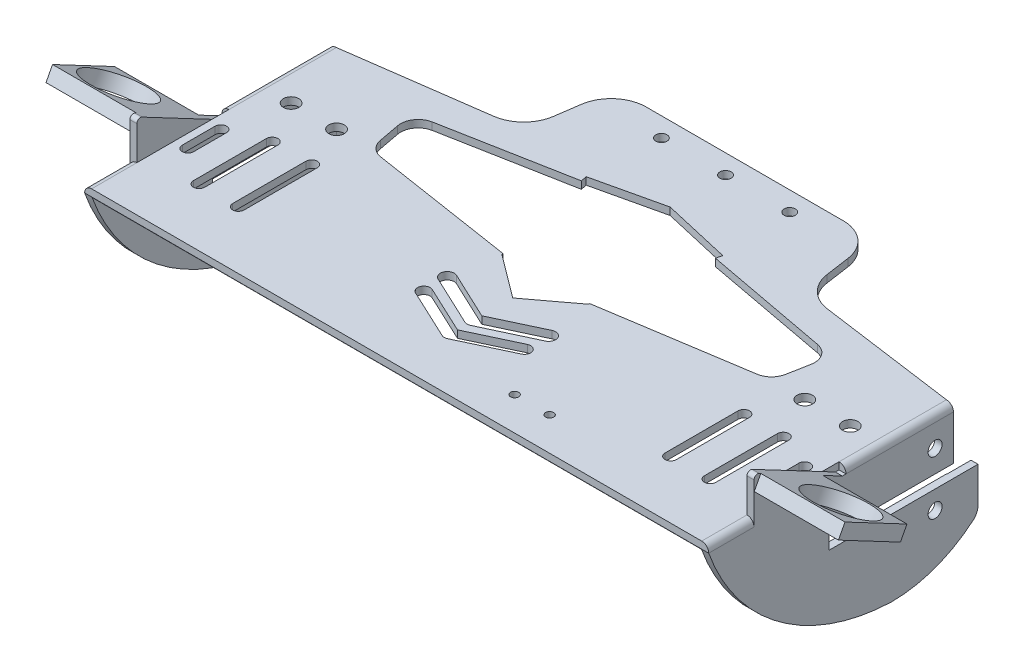
from build123d import *

# Parameters (mm, degrees)
SKETCH_1_W                  = 178
SKETCH_1_H                  = 99.3
EXTRUDE_1_DEPTH             = 40.1
SKETCH_2_W                  = 173.8
SKETCH_2_H                  = 38
CUT_EXTRUDE_1_DEPTH         = 140.246184867
FILLET_2_R                  = 2
CUT_EXTRUDE_2_DEPTH         = 110.517726876
CUT_EXTRUDE_3_DEPTH         = 110.517726876
SKETCH_8_R                  = 2.2
SKETCH_8_R_2                = 1.6
CUT_EXTRUDE_4_DEPTH         = 110.517726876
CUT_EXTRUDE_START           = -178
CUT_EXTRUDE_6_DEPTH         = 178
CUT_EXTRUDE_START_2         = -2
CUT_EXTRUDE_6_2_OUTLINE_W   = 15.371880512
CUT_EXTRUDE_6_2_OUTLINE_H   = 8.546668637
CUT_EXTRUDE_6_2_OUTLINE_W_2 = 50.8
CUT_EXTRUDE_6_2_OUTLINE_H_2 = 3.7
CUT_EXTRUDE_6_2_DEPTH       = 2
CUT_EXTRUDE_START_3         = -2.1
CUT_EXTRUDE_6_3_OUTLINE_W   = 50.8
CUT_EXTRUDE_6_3_OUTLINE_H   = 3.7
CUT_EXTRUDE_6_3_DEPTH       = 0.1
CUT_EXTRUDE_7_REACH         = 191.096
SKETCH_12_W                 = 50.840355568
SKETCH_12_H                 = 3.7
SKETCH_12_W_2               = 15.371880512
SKETCH_12_H_2               = 8.546668637
CUT_EXTRUDE_8_DEPTH         = 190.095564464
CUT_EXTRUDE_9_DEPTH         = 190.095564464
CUT_EXTRUDE_9_DEPTH_BACK    = 190.095564464
SKETCH_14_W                 = 15.371880512
SKETCH_14_H                 = 6.177592496
FILLET_5_R                  = 2
FILLET_6_R                  = 2
SKETCH_15_W                 = 44.8
SKETCH_15_H                 = 10.5
EXTRUDE_2_DEPTH             = 2
EXTRUDE_3_DEPTH             = 20
SKETCH_17_R                 = 9
CUT_EXTRUDE_10_DEPTH        = 5
SKETCH_18_W                 = 12.418304002
SKETCH_18_H                 = 16.745033667
CUT_EXTRUDE_11_DEPTH        = 2
EXTRUDE_4_DEPTH             = 4
EXTRUDE_5_DEPTH             = 1.5
SKETCH_21_W                 = 13.4371469
SKETCH_21_H                 = 20.281056592
CUT_EXTRUDE_12_DEPTH        = 2
CUT_EXTRUDE_13_DEPTH        = 6
SKETCH_23_W                 = 17.8776686
SKETCH_23_H                 = 8.373981463
SKETCH_23_W_2               = 13.636767664
SKETCH_23_H_2               = 13.001155611
CUT_EXTRUDE_14_DEPTH        = 4
FILLET_12_R                 = 0.5
SKETCH_25_R                 = 1.15
CUT_EXTRUDE_15_DEPTH        = 5
CUT_EXTRUDE_17_DEPTH        = 2
CUT_EXTRUDE_18_DEPTH        = 2
SKETCH_33_W                 = 239.619275189
SKETCH_33_H                 = 161.385039832
CUT_EXTRUDE_19_DEPTH        = 35
SKETCH_35_W                 = 479.848395458
SKETCH_35_H                 = 293.507268555
CUT_EXTRUDE_20_DEPTH        = 13
SKETCH_36_W                 = 75.880372154
SKETCH_36_H                 = 5.674586768
CUT_EXTRUDE_21_DEPTH        = 2
SKETCH_39_W                 = 69.8
SKETCH_39_H                 = 2
EXTRUDE_6_DEPTH             = 2
SKETCH_38_R                 = 2
CUT_EXTRUDE_25_DEPTH        = 201
FILLET_13_R                 = 2
CUT_EXTRUDE_22_DEPTH        = 2
EXTRUDE_7_DEPTH             = 2
EXTRUDE_8_DEPTH             = 24
SKETCH_51_R                 = 9
CUT_EXTRUDE_26_DEPTH        = 5
FILLET_14_R                 = 1
SKETCH_52_W                 = 10.388270982
SKETCH_52_H                 = 13.498276643
CUT_EXTRUDE_27_DEPTH        = 178
FILLET_16_R                 = 4


# Read off the part's stored shape, not the designer's step: 切除-拉伸6
with BuildPart() as part:
    # 草图1 → 凸台-拉伸1 (new body)
    with BuildSketch(Plane(origin=(0, 0, 0), x_dir=(1, 0, 0), z_dir=(0, 1, 0))):
        Rectangle(SKETCH_1_W, SKETCH_1_H)
    extrude(amount=EXTRUDE_1_DEPTH)

    # 草图2 → 切除-拉伸1 (cut, through all)
    with BuildSketch(Plane.XY.offset(49.65)):
        with Locations((0, 19)):
            Rectangle(SKETCH_2_W, SKETCH_2_H)
    extrude(amount=-CUT_EXTRUDE_1_DEPTH, mode=Mode.SUBTRACT)

    # 圆角2
    fillet_2_edges = [part.edges().sort_by_distance(p)[0] for p in [
        (-89, 40.1, 0),
        (89, 40.1, 0),
    ]]
    fillet(fillet_2_edges, radius=FILLET_2_R)

    # 草图4 → 切除-拉伸2 (cut, through all)
    with BuildSketch(Plane(origin=(0, 40.1, 0), x_dir=(1, 0, 0), z_dir=(0, 1, 0))):
        with BuildLine():
            Line((-36.8, 49.65), (-39.030851371, 34.101641958))
            ThreePointArc((-39.030851371, 34.101641958), (-41.87537216, 28.433897016), (-47.556677901, 25.6165585))
            Line((-47.556677901, 25.6165585), (-87, 20.15))
            Line((-87, 20.15), (-87, 35.521880512))
            Line((-87, 35.521880512), (-89, 35.521880512))
            Line((-89, 35.521880512), (-89, 49.65))
            Line((-89, 49.65), (-87, 49.65))
            Line((-87, 49.65), (-36.8, 49.65))
        make_face()
        with BuildLine():
            Line((36.8, 49.65), (39.030851371, 34.101641958))
            ThreePointArc((39.030851371, 34.101641958), (41.87537216, 28.433897016), (47.556677901, 25.6165585))
            Line((47.556677901, 25.6165585), (87, 20.15))
            Line((87, 20.15), (87, 35.521880512))
            Line((87, 35.521880512), (89, 35.521880512))
            Line((89, 35.521880512), (89, 49.65))
            Line((89, 49.65), (87, 49.65))
            Line((87, 49.65), (36.8, 49.65))
        make_face()
    extrude(amount=-CUT_EXTRUDE_2_DEPTH, mode=Mode.SUBTRACT)

    # 草图6 → 切除-拉伸3 (cut, through all)
    with BuildSketch(Plane(origin=(0, 40.1, 0), x_dir=(1, 0, 0), z_dir=(0, 1, 0))):
        with BuildLine():
            Line((-36.8, 49.65), (-38.031009251, 41.070238555))
            ThreePointArc((-38.031009251, 41.070238555), (-34.682095001, 47.206533119), (-28.132376898, 49.65))
            Line((-28.132376898, 49.65), (-36.8, 49.65))
        make_face()
        with BuildLine():
            Line((28.132376898, 49.65), (36.8, 49.65))
            Line((36.8, 49.65), (38.031009251, 41.070238555))
            ThreePointArc((38.031009251, 41.070238555), (34.682095001, 47.206533119), (28.132376898, 49.65))
        make_face()
    extrude(amount=-CUT_EXTRUDE_3_DEPTH, mode=Mode.SUBTRACT)

    # 草图8 → 切除-拉伸4 (cut, through all)
    with BuildSketch(Plane(origin=(0, 40.1, 0), x_dir=(1, 0, 0), z_dir=(0, 1, 0))):
        with Locations(Location((-66.772751143, -0.015717315, 0), (0, 0, 270))):
            Circle(SKETCH_8_R)
        with Locations(Location((-79.744808128, -0.015717315, 0), (0, 0, 270))):
            Circle(SKETCH_8_R)
        with Locations(Location((79.744808128, -0.015717315, 0), (0, 0, 270))):
            Circle(SKETCH_8_R)
        with Locations(Location((66.772751143, -0.015717315, 0), (0, 0, 270))):
            Circle(SKETCH_8_R)
        with Locations(Location((-18.3, 44.15, 0), (0, 0, 270))):
            Circle(SKETCH_8_R_2)
        with Locations(Location((0, 44.15, 0), (0, 0, 270))):
            Circle(SKETCH_8_R_2)
        with Locations(Location((18.3, 44.15, 0), (0, 0, 270))):
            Circle(SKETCH_8_R_2)
        Polygon((0, 28.35), (-19.5, 23.865395458), (-12.327874499, -7.320508663), (0, -16.55), (12.327874499, -7.320508663), (19.5, 23.865395458), align=None)
        with BuildLine():
            Line((-0.841570701, -29.340722492), (-15.30536404, -22.541191788))
            ThreePointArc((-15.30536404, -22.541191788), (-16.253961694, -19.909452732), (-13.622222639, -18.960855078))
            Line((-13.622222639, -18.960855078), (0, -25.364757493))
            Line((0, -25.364757493), (13.622222639, -18.960855078))
            ThreePointArc((13.622222639, -18.960855078), (16.253961694, -19.909452732), (15.30536404, -22.541191788))
            Line((15.30536404, -22.541191788), (0.759805991, -29.340722492))
            ThreePointArc((0.759805991, -29.340722492), (-0.040882355, -29.529794577), (-0.841570701, -29.340722492))
        make_face()
        with BuildLine():
            Line((-0.761506944, -35.907039665), (-15.091492685, -29.170412851))
            ThreePointArc((-15.091492685, -29.170412851), (-15.949844455, -26.789047193), (-13.568478797, -25.930695423))
            Line((-13.568478797, -25.930695423), (0, -32.309332481))
            Line((0, -32.309332481), (13.568478797, -25.930695423))
            ThreePointArc((13.568478797, -25.930695423), (15.949844455, -26.789047193), (15.091492685, -29.170412851))
            Line((15.091492685, -29.170412851), (0.761506944, -35.907039665))
            ThreePointArc((0.761506944, -35.907039665), (0, -36.077106949), (-0.761506944, -35.907039665))
        make_face()
        with BuildLine():
            Line((22.519031751, 16.438607072), (19.604247718, 0.906493347))
            ThreePointArc((19.604247718, 0.906493347), (20.928314771, -3.495778271), (25.287228663, -4.956264026))
            Line((25.287228663, -4.956264026), (53.645829787, -0.543579577))
            ThreePointArc((53.645829787, -0.543579577), (56.357126672, 0.806817312), (57.791282591, 3.474756472))
            Line((57.791282591, 3.474756472), (58.941416792, 9.603517642))
            ThreePointArc((58.941416792, 9.603517642), (58.154177406, 13.348502968), (54.949410579, 15.439945179))
            Line((54.949410579, 15.439945179), (28.355459288, 20.430613285))
            ThreePointArc((28.355459288, 20.430613285), (24.610473962, 19.6433739), (22.519031751, 16.438607072))
        make_face()
        with BuildLine():
            Line((-57.791282591, 3.474756472), (-58.941416792, 9.603517642))
            ThreePointArc((-58.941416792, 9.603517642), (-58.154177406, 13.348502968), (-54.949410579, 15.439945179))
            Line((-54.949410579, 15.439945179), (-28.355459288, 20.430613285))
            ThreePointArc((-28.355459288, 20.430613285), (-24.610473962, 19.6433739), (-22.519031751, 16.438607072))
            Line((-22.519031751, 16.438607072), (-19.604247718, 0.906493347))
            ThreePointArc((-19.604247718, 0.906493347), (-20.928314771, -3.495778271), (-25.287228663, -4.956264026))
            Line((-25.287228663, -4.956264026), (-53.645829787, -0.543579577))
            ThreePointArc((-53.645829787, -0.543579577), (-56.357126672, 0.806817312), (-57.791282591, 3.474756472))
        make_face()
        with BuildLine():
            Line((-71.255476203, -12.280373493), (-71.255476203, -33.132569373))
            ThreePointArc((-71.255476203, -33.132569373), (-72.878701032, -34.755794202), (-74.501925861, -33.132569373))
            Line((-74.501925861, -33.132569373), (-74.501925861, -12.280373493))
            ThreePointArc((-74.501925861, -12.280373493), (-72.878701032, -10.657148664), (-71.255476203, -12.280373493))
        make_face()
        with BuildLine():
            Line((-60.017765848, -12.280373493), (-60.017765848, -33.132569373))
            ThreePointArc((-60.017765848, -33.132569373), (-61.640990677, -34.755794202), (-63.264215506, -33.132569373))
            Line((-63.264215506, -33.132569373), (-63.264215506, -12.280373493))
            ThreePointArc((-63.264215506, -12.280373493), (-61.640990677, -10.657148664), (-60.017765848, -12.280373493))
        make_face()
        with BuildLine():
            Line((-81.619142419, -16.55), (-81.619142419, -25.930695423))
            ThreePointArc((-81.619142419, -25.930695423), (-83.242367248, -27.553920252), (-84.865592077, -25.930695423))
            Line((-84.865592077, -25.930695423), (-84.865592077, -16.55))
            ThreePointArc((-84.865592077, -16.55), (-83.242367248, -14.926775171), (-81.619142419, -16.55))
        make_face()
        with BuildLine():
            Line((60.017765848, -12.280373493), (60.017765848, -33.132569373))
            ThreePointArc((60.017765848, -33.132569373), (61.640990677, -34.755794202), (63.264215506, -33.132569373))
            Line((63.264215506, -33.132569373), (63.264215506, -12.280373493))
            ThreePointArc((63.264215506, -12.280373493), (61.640990677, -10.657148664), (60.017765848, -12.280373493))
        make_face()
        with BuildLine():
            Line((71.255476203, -12.280373493), (71.255476203, -33.132569373))
            ThreePointArc((71.255476203, -33.132569373), (72.878701032, -34.755794202), (74.501925861, -33.132569373))
            Line((74.501925861, -33.132569373), (74.501925861, -12.280373493))
            ThreePointArc((74.501925861, -12.280373493), (72.878701032, -10.657148664), (71.255476203, -12.280373493))
        make_face()
        with BuildLine():
            Line((81.619142419, -16.55), (81.619142419, -25.930695423))
            ThreePointArc((81.619142419, -25.930695423), (83.242367248, -27.553920252), (84.865592077, -25.930695423))
            Line((84.865592077, -25.930695423), (84.865592077, -16.55))
            ThreePointArc((84.865592077, -16.55), (83.242367248, -14.926775171), (81.619142419, -16.55))
        make_face()
    extrude(amount=-CUT_EXTRUDE_4_DEPTH, mode=Mode.SUBTRACT)

    # 切除-拉伸6 outline → 切除-拉伸6 (cut)
    with BuildSketch(Plane.ZY.offset(89).offset(CUT_EXTRUDE_START)):
        with BuildLine():
            ThreePointArc((49.65, 38.1), (29.434075278, 11.013458724), (-2.520080283, 0))
            Line((-2.520080283, 0), (49.65, 0))
            Line((49.65, 0), (49.65, 38.1))
        make_face()
    extrude(amount=CUT_EXTRUDE_6_DEPTH, mode=Mode.SUBTRACT)

    # Cut-Extrude 6 2 outline → Cut-Extrude 6 2 (cut)
    with BuildSketch(Plane.ZY.offset(89).offset(CUT_EXTRUDE_START_2)):
        with Locations((-27.835940256, 35.826665682)):
            Rectangle(CUT_EXTRUDE_6_2_OUTLINE_W, CUT_EXTRUDE_6_2_OUTLINE_H)
        with BuildLine():
            ThreePointArc((-8.239595488, 0), (-24.308667036, 7.781943526), (-35.521880512, 21.675738867))
            Line((-35.521880512, 21.675738867), (-35.521880512, 0))
            Line((-35.521880512, 0), (-8.239595488, 0))
        make_face()
        with Locations((-10.121880512, 23.525738867)):
            Rectangle(CUT_EXTRUDE_6_2_OUTLINE_W_2, CUT_EXTRUDE_6_2_OUTLINE_H_2)
    extrude(amount=CUT_EXTRUDE_6_2_DEPTH, mode=Mode.SUBTRACT)

    # Cut-Extrude 6 3 outline → Cut-Extrude 6 3 (cut)
    with BuildSketch(Plane.ZY.offset(89).offset(CUT_EXTRUDE_START_3)):
        with BuildLine():
            ThreePointArc((-8.239595488, 0), (-24.308667036, 7.781943526), (-35.521880512, 21.675738867))
            Line((-35.521880512, 21.675738867), (-35.521880512, 0))
            Line((-35.521880512, 0), (-8.239595488, 0))
        make_face()
        with Locations((-10.121880512, 23.525738867)):
            Rectangle(CUT_EXTRUDE_6_3_OUTLINE_W, CUT_EXTRUDE_6_3_OUTLINE_H)
    extrude(amount=CUT_EXTRUDE_6_3_DEPTH, mode=Mode.SUBTRACT)

    # 草图12 → 切除-拉伸7 (cut, up to next)
    with BuildSketch(Plane(origin=(89, 0, 0), x_dir=(0, 0, -1), z_dir=(1, 0, 0)), mode=Mode.PRIVATE) as cut_extrude_7_sk1:
        with Locations((10.101702728, 23.525738867)):
            Rectangle(SKETCH_12_W, SKETCH_12_H)
    cut_extrude_7_tool1 = extrude(cut_extrude_7_sk1.sketch, amount=-CUT_EXTRUDE_7_REACH, mode=Mode.PRIVATE) & part.part
    # 草图12 → 切除-拉伸7 (cut, up to next)
    with BuildSketch(Plane(origin=(89, 0, 0), x_dir=(0, 0, -1), z_dir=(1, 0, 0)), mode=Mode.PRIVATE) as cut_extrude_7_sk2:
        with Locations((27.835940256, 35.826665682)):
            Rectangle(SKETCH_12_W_2, SKETCH_12_H_2)
    cut_extrude_7_tool2 = extrude(cut_extrude_7_sk2.sketch, amount=-CUT_EXTRUDE_7_REACH, mode=Mode.PRIVATE) & part.part
    add(cut_extrude_7_tool1.solids().sort_by_distance((89, 23.525739, -10.101703))[0], mode=Mode.SUBTRACT)
    add(cut_extrude_7_tool2.solids().sort_by_distance((89, 35.826666, -27.83594))[0], mode=Mode.SUBTRACT)

    # 草图13 → 切除-拉伸8 (cut, through all)
    with BuildSketch(Plane(origin=(89, 0, 0), x_dir=(0, 0, -1), z_dir=(1, 0, 0))):
        with BuildLine():
            Line((35.521880512, 21.675738867), (35.521880512, 0))
            Line((35.521880512, 0), (2.520080283, 0))
            ThreePointArc((2.520080283, 0), (22.261891711, 5.903509024), (35.521880512, 21.675738867))
        make_face()
    extrude(amount=-CUT_EXTRUDE_8_DEPTH, mode=Mode.SUBTRACT)

    # 草图14 → 切除-拉伸9 (cut, two sides: drawn at the far end of the back side and taken through both)
    with BuildSketch(Plane.ZY.offset(89).offset(-CUT_EXTRUDE_9_DEPTH_BACK)):
        with Locations((-27.835940256, 28.464535115)):
            Rectangle(SKETCH_14_W, SKETCH_14_H)
    extrude(amount=CUT_EXTRUDE_9_DEPTH + CUT_EXTRUDE_9_DEPTH_BACK, mode=Mode.SUBTRACT)

    # 圆角5
    fillet_5_edges = [part.edges().sort_by_distance(p)[0] for p in [
        (-88, 21.675738867, -35.521880512),
    ]]
    fillet(fillet_5_edges, radius=FILLET_5_R)

    # 圆角6
    fillet_6_edges = [part.edges().sort_by_distance(p)[0] for p in [
        (88, 21.675738867, -35.521880512),
    ]]
    fillet(fillet_6_edges, radius=FILLET_6_R)

    # 草图15 → 凸台-拉伸2 (add)
    with BuildSketch(Plane(origin=(89, 0, 0), x_dir=(0, 0, -1), z_dir=(1, 0, 0))):
        with Locations((-15.063056401, 32.85)):
            Rectangle(SKETCH_15_W, SKETCH_15_H)
    extrude_2 = extrude(amount=EXTRUDE_2_DEPTH)

    # 草图16 → 凸台-拉伸3 (add)
    with BuildSketch(Plane(origin=(91, 0, 0), x_dir=(0, 0, -1), z_dir=(1, 0, 0))):
        Polygon((-30.601535187, 43.117688419), (-29.435087768, 44.742311581), (-13.203154802, 33.057922285), (-15.536049638, 29.80867596), (-31.782281263, 41.473150144), align=None)
    extrude_3 = extrude(amount=EXTRUDE_3_DEPTH)

    # 草图17 → 切除-拉伸10 (cut)
    with BuildSketch(Plane(origin=(0, 15.514587175, -11.168015337), x_dir=(1, 0, 0), z_dir=(0, 0.8115960385546609, -0.5842190258818875))):
        with Locations(Location((101, -40.028702802, 0), (0, 0, 270))):
            Circle(SKETCH_17_R)
    cut_extrude_10 = extrude(amount=-CUT_EXTRUDE_10_DEPTH, mode=Mode.SUBTRACT)

    # 草图18 → 切除-拉伸11 (cut)
    with BuildSketch(Plane(origin=(89, 0, 0), x_dir=(0, 0, -1), z_dir=(1, 0, 0))):
        with Locations((-26.280150153, 46.472516834)):
            Rectangle(SKETCH_18_W, SKETCH_18_H)
    extrude(amount=-CUT_EXTRUDE_11_DEPTH, mode=Mode.SUBTRACT)

    # 草图19 → 凸台-拉伸4 (add)
    with BuildSketch(Plane.ZY.offset(-91)):
        Polygon((20.207600255, 38.1), (29.435087768, 44.742311581), (31.782281263, 46.431914576), (31.782281263, 41.473150144), (31.782281263, 38.1), align=None)
    extrude_4 = extrude(amount=EXTRUDE_4_DEPTH)

    # 草图20 → 凸台-拉伸5 (add)
    with BuildSketch(Plane.ZY.offset(-87)):
        Polygon((22.985996722, 40.1), (31.782281263, 40.1), (31.782281263, 46.431914576), align=None)
    extrude_5 = extrude(amount=EXTRUDE_5_DEPTH)

    # 草图21 → 切除-拉伸12 (cut)
    with BuildSketch(Plane.ZY.offset(89)):
        with Locations((25.779361605, 48.240528296)):
            Rectangle(SKETCH_21_W, SKETCH_21_H)
    extrude(amount=-CUT_EXTRUDE_12_DEPTH, mode=Mode.SUBTRACT)

    # 镜向2: 凸台-拉伸2, 凸台-拉伸3, 切除-拉伸10, 凸台-拉伸4, 凸台-拉伸5 across plane
    add(extrude_2.mirror(Plane.ZY))
    add(extrude_3.mirror(Plane.ZY))
    add(cut_extrude_10.mirror(Plane.ZY), mode=Mode.SUBTRACT)
    add(extrude_4.mirror(Plane.ZY))
    add(extrude_5.mirror(Plane.ZY))

    # 草图22 → 切除-拉伸13 (cut)
    with BuildSketch(Plane(origin=(0, 40.1, 0), x_dir=(1, 0, 0), z_dir=(0, 1, 0))):
        with BuildLine():
            Line((-28.355459288, 20.430613285), (-19.109126701, 22.165796472))
            Line((-19.109126701, 22.165796472), (-12.410813305, -6.959873356))
            Line((-12.410813305, -6.959873356), (-25.287228663, -4.956264026))
            ThreePointArc((-25.287228663, -4.956264026), (-20.928314771, -3.495778271), (-19.604247718, 0.906493347))
            Line((-19.604247718, 0.906493347), (-22.519031751, 16.438607072))
            ThreePointArc((-22.519031751, 16.438607072), (-24.610473962, 19.6433739), (-28.355459288, 20.430613285))
        make_face()
        with BuildLine():
            Line((28.355459288, 20.430613285), (19.109126701, 22.165796472))
            Line((19.109126701, 22.165796472), (12.410813305, -6.959873356))
            Line((12.410813305, -6.959873356), (25.287228663, -4.956264026))
            ThreePointArc((25.287228663, -4.956264026), (20.928314771, -3.495778271), (19.604247718, 0.906493347))
            Line((19.604247718, 0.906493347), (22.519031751, 16.438607072))
            ThreePointArc((22.519031751, 16.438607072), (24.610473962, 19.6433739), (28.355459288, 20.430613285))
        make_face()
    extrude(amount=-CUT_EXTRUDE_13_DEPTH, mode=Mode.SUBTRACT)

    # 草图23 → 切除-拉伸14 (cut)
    with BuildSketch(Plane(origin=(0, 30.622300596, 42.65061421), x_dir=(1, 0, 0), z_dir=(0, 0.583223709196944, 0.812311581248574))):
        with Locations((-87.85316376, 20.690087152)):
            Rectangle(SKETCH_23_W, SKETCH_23_H)
        with Locations((88.749444985, 20.068925468)):
            Rectangle(SKETCH_23_W_2, SKETCH_23_H_2)
    extrude(amount=CUT_EXTRUDE_14_DEPTH, mode=Mode.SUBTRACT)

    # 圆角12
    # the kernel refuses this fillet: 0.5 mm, written as the material it takes off along each edge
    with BuildSketch(Plane(origin=(-84.248466774, 46.202860243, 31.464079389), x_dir=(0, -0.5842190258818821, -0.8115960385546648), z_dir=(-1, 0, 0))) as fillet_12_piece_1:
        with BuildLine():
            CenterArc((FILLET_12_R * 1.00122658098, FILLET_12_R), FILLET_12_R, 179.92976517, 90.07023483)
            Line((FILLET_12_R * 0.00122733231243, FILLET_12_R * 1.00122582873), (0, 0))
            Line((0, 0), (FILLET_12_R * 1.00122658098, 0))
        make_face()
    extrude(amount=8.003066452, mode=Mode.SUBTRACT)
    with BuildSketch(Plane(origin=(-91.402265065, 45.759669983, 31.782281263), x_dir=(0, -1, 0), z_dir=(1, 0, 0))) as fillet_12_piece_2:
        with BuildLine():
            CenterArc((FILLET_12_R * 0.321812052205, FILLET_12_R), FILLET_12_R, 234.322397917, 35.677602083)
            Line((-FILLET_12_R * 0.261411656992, FILLET_12_R * 0.187688418751), (0, 0))
            Line((0, 0), (FILLET_12_R * 0.321812052205, 0))
        make_face()
    extrude(amount=6.304530131, mode=Mode.SUBTRACT)

    # 草图25 → 切除-拉伸15 (cut)
    with BuildSketch(Plane(origin=(0, 40.1, 0), x_dir=(1, 0, 0), z_dir=(0, 1, 0))):
        with Locations(Location((24.13274334, -40.15, 0), (0, 0, 270))):
            Circle(SKETCH_25_R)
        with Locations(Location((34.13274334, -40.15, 0), (0, 0, 270))):
            Circle(SKETCH_25_R)
    extrude(amount=-CUT_EXTRUDE_15_DEPTH, mode=Mode.SUBTRACT)

    # 草图28 → 切除-拉伸17 (cut)
    with BuildSketch(Plane(origin=(91, 0, 0), x_dir=(0, 0, -1), z_dir=(1, 0, 0))):
        Polygon((-31.782281263, 38.1), (-37.463056401, 38.1), (-37.463056401, 27.6), (7.336943599, 27.6), (7.336943599, 38.1), (-12.015291665, 38.1), (-13.203154802, 38.1), (-13.203154802, 33.057922285), (-13.203154802, 29.371898305), (-31.782281263, 29.371898305), align=None)
    cut_extrude_17 = extrude(amount=-CUT_EXTRUDE_17_DEPTH, mode=Mode.SUBTRACT)

    # 镜向3: 切除-拉伸17 across plane
    add(cut_extrude_17.mirror(Plane.ZY), mode=Mode.SUBTRACT)

    # 草图30 → 切除-拉伸18 (cut)
    with BuildSketch(Plane.ZY.offset(91)):
        Polygon((15.536049638, 29.80867596), (31.782281263, 41.473150144), (31.782281263, 29.371898305), (14.927707519, 29.371898305), align=None)
        Polygon((13.203154802, 33.057922285), (13.203154802, 38.1), (20.207600255, 38.1), align=None)
    cut_extrude_18 = extrude(amount=-CUT_EXTRUDE_18_DEPTH, mode=Mode.SUBTRACT)

    # 镜向4: 切除-拉伸18 across plane
    add(cut_extrude_18.mirror(Plane.ZY), mode=Mode.SUBTRACT)

    # 草图33 → 切除-拉伸19 (cut)
    with BuildSketch(Plane(origin=(89, 0, 0), x_dir=(0, 0, -1), z_dir=(1, 0, 0))):
        with Locations((-65.713237517, 68.411947431)):
            Rectangle(SKETCH_33_W, SKETCH_33_H)
    cut_extrude_19 = extrude(amount=CUT_EXTRUDE_19_DEPTH, mode=Mode.SUBTRACT)

    # 镜向5: 切除-拉伸19 across plane
    add(cut_extrude_19.mirror(Plane.ZY), mode=Mode.SUBTRACT)

    # 草图35 → 切除-拉伸20 (cut)
    with BuildSketch(Plane(origin=(0, 40.1, 0), x_dir=(1, 0, 0), z_dir=(0, 1, 0))):
        with Locations((-114.491538091, 73.937508002)):
            Rectangle(SKETCH_35_W, SKETCH_35_H)
    extrude(amount=CUT_EXTRUDE_20_DEPTH, mode=Mode.SUBTRACT)

    # 草图36 → 切除-拉伸21 (cut)
    with BuildSketch(Plane(origin=(87, 0, 0), x_dir=(0, 0, -1), z_dir=(1, 0, 0))):
        with Locations((-15.477236508, 40.937293384)):
            Rectangle(SKETCH_36_W, SKETCH_36_H)
    cut_extrude_21 = extrude(amount=CUT_EXTRUDE_21_DEPTH, mode=Mode.SUBTRACT)

    # 镜向6: 切除-拉伸21 across plane
    add(cut_extrude_21.mirror(Plane.ZY), mode=Mode.SUBTRACT)

    # 草图39 → 凸台-拉伸6 (add)
    with BuildSketch(Plane(origin=(87, 0, 0), x_dir=(0, 0, -1), z_dir=(1, 0, 0))):
        with Locations((-14.75, 39.1)):
            Rectangle(SKETCH_39_W, SKETCH_39_H)
    extrude_6 = extrude(amount=EXTRUDE_6_DEPTH)

    # 草图38 → 切除-拉伸25 (cut)
    with BuildSketch(Plane(origin=(89, 0, 0), x_dir=(0, 0, -1), z_dir=(1, 0, 0))):
        with Locations((14.904107264, 31.737869433)):
            Circle(SKETCH_38_R)
        with Locations((14.904107264, 16.388826548)):
            Circle(SKETCH_38_R)
    extrude(amount=-CUT_EXTRUDE_25_DEPTH, mode=Mode.SUBTRACT)

    # 镜向7: 凸台-拉伸6 across plane
    add(extrude_6.mirror(Plane.ZY))

    # 圆角13
    fillet_13_edges = [part.edges().sort_by_distance(p)[0] for p in [
        (89, 40.1, 14.75),
        (-89, 40.1, 14.75),
    ]]
    fillet(fillet_13_edges, radius=FILLET_13_R)

    # 草图40 → 切除-拉伸22 (cut)
    with BuildSketch(Plane(origin=(89, 0, 0), x_dir=(0, 0, -1), z_dir=(1, 0, 0))):
        Polygon((-26.65, 40.358725967), (-22.361179312, 40.358725967), (-21.00258234, 40.358725967), (-14.147035829, 40.358725967), (-10.492377946, 40.358725967), (-10.492377946, 38.1), (-14.147035829, 38.1), (-21.00258234, 38.1), (-22.361179312, 38.1), (-26.65, 38.1), (-36.735593046, 38.1), (-36.735593046, 40.358725967), align=None)
    cut_extrude_22 = extrude(amount=-CUT_EXTRUDE_22_DEPTH, mode=Mode.SUBTRACT)

    # 镜向8: 切除-拉伸22 across plane
    add(cut_extrude_22.mirror(Plane.ZY), mode=Mode.SUBTRACT)

    # 草图41 → 凸台-拉伸7 (add)
    with BuildSketch(Plane(origin=(87, 0, 0), x_dir=(0, 0, -1), z_dir=(1, 0, 0))):
        Polygon((-36.735593046, 38.1), (-11.535593046, 38.1), (-36.735593046, 51.4), align=None)
    extrude_7 = extrude(amount=EXTRUDE_7_DEPTH)

    # 草图50 → 凸台-拉伸8 (add)
    with BuildSketch(Plane(origin=(89, 0, 0), x_dir=(0, 0, -1), z_dir=(1, 0, 0))):
        Polygon((-34.78994659, 50.373131037), (-36.656981068, 46.835592026), (-18.969286011, 37.500419634), (-17.102251533, 41.037958646), align=None)
    extrude_8 = extrude(amount=EXTRUDE_8_DEPTH)

    # 草图51 → 切除-拉伸26 (cut)
    with BuildSketch(Plane(origin=(0, 25.037570523, -13.214273332), x_dir=(1, 0, 0), z_dir=(0, 0.8843847528469697, -0.46675861955812287))):
        with Locations(Location((103, -44.279791422, 0), (0, 0, 270))):
            Circle(SKETCH_51_R)
    cut_extrude_26 = extrude(amount=-CUT_EXTRUDE_26_DEPTH, mode=Mode.SUBTRACT)

    # 镜向9: 凸台-拉伸7 across plane
    add(extrude_7.mirror(Plane.ZY))

    # 镜向10: 凸台-拉伸8 across plane
    add(extrude_8.mirror(Plane.ZY))

    # 镜向11: 切除-拉伸26 across plane
    add(cut_extrude_26.mirror(Plane.ZY), mode=Mode.SUBTRACT)

    # 圆角14
    fillet_14_edges = [part.edges().sort_by_distance(p)[0] for p in [
        (88, 51.4, 36.735593046),
        (-88, 51.4, 36.735593046),
    ]]
    fillet(fillet_14_edges, radius=FILLET_14_R)

    # 草图52 → 切除-拉伸27 (cut)
    with BuildSketch(Plane(origin=(89, 0, 0), x_dir=(0, 0, -1), z_dir=(1, 0, 0))):
        with Locations((32.344135491, 14.926600546)):
            Rectangle(SKETCH_52_W, SKETCH_52_H)
    extrude(amount=-CUT_EXTRUDE_27_DEPTH, mode=Mode.SUBTRACT)

    # 圆角16
    fillet_16_edges = [part.edges().sort_by_distance(p)[0] for p in [
        (88, 9.75875073, -27.15),
        (-88, 10.261792079, -27.15),
    ]]
    fillet(fillet_16_edges, radius=FILLET_16_R)


solid = part.part
